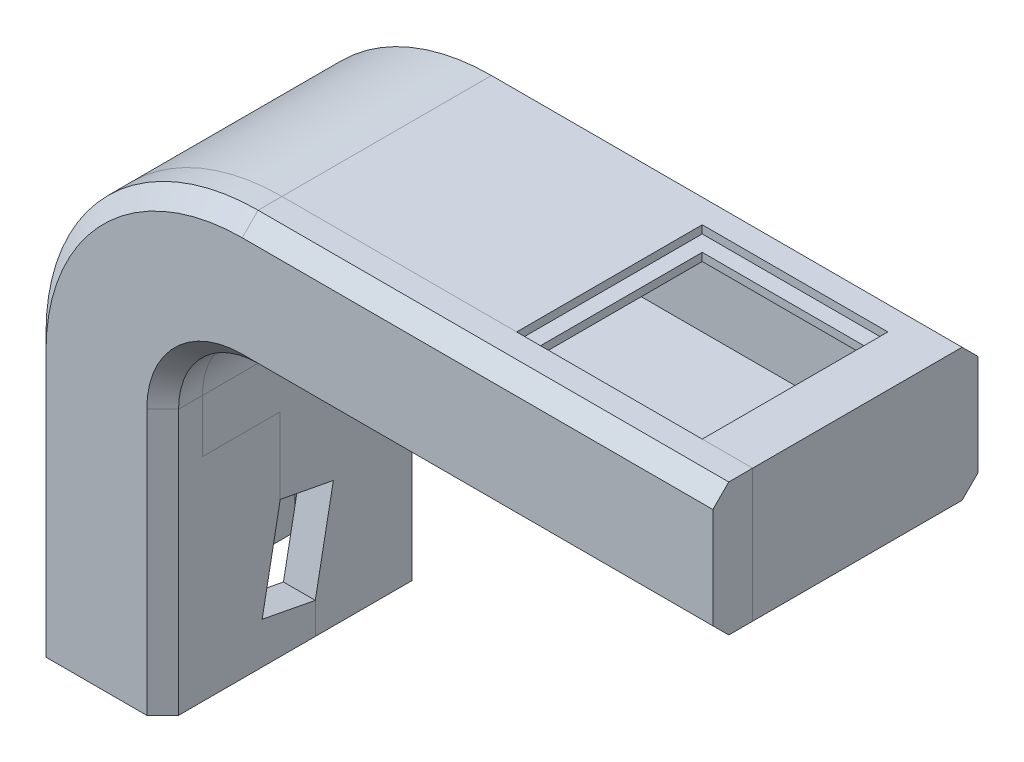
from build123d import *

# Parameters (mm, degrees)
BOSS_EXTRUDE1_DEPTH       = 25
FILLET2_R                 = 15
FILLET3_R                 = 40
FILLET1_SIZE              = 3
SHELL1_T                  = -6
SHELL1_THICKNESS_2_FACE_W = 13
SHELL1_THICKNESS_2_FACE_H = 38
SHELL1_THICKNESS_2_DEPTH  = 4
CUT_EXTRUDE1_DEPTH        = 165.928961981
CUT_EXTRUDE2_REACH        = 140.123
SKETCH3_W                 = 35
SKETCH3_H                 = 35
CUT_EXTRUDE3_DEPTH        = 39.1
CUT_EXTRUDE3_DEPTH_BACK   = 4.1
SKETCH4_W                 = 43.2
SKETCH4_H                 = 3
SPLIT1_SURFACE_1_BACK     = 165.853
SPLIT1_SURFACE_1_DEPTH    = 331.706
SPLIT1_SURFACE_2_BACK     = 165.853
SPLIT1_SURFACE_2_DEPTH    = 331.706


with BuildPart() as part:
    # Sketch1 → Boss-Extrude1 (new, symmetric)
    with BuildSketch(Plane.XY):
        Polygon((-101.75, 10), (-76.75, 10), (-76.75, 75), (27, 75), (27, 100), (-101.75, 100), align=None)
    extrude(amount=BOSS_EXTRUDE1_DEPTH, both=True)

    # Fillet2
    fillet2_edges = [part.edges().sort_by_distance(p)[0] for p in [
        (-76.75, 75, 0),
    ]]
    fillet(fillet2_edges, radius=FILLET2_R)

    # Fillet3
    fillet3_edges = [part.edges().sort_by_distance(p)[0] for p in [
        (-101.75, 100, 0),
    ]]
    fillet(fillet3_edges, radius=FILLET3_R)

    # Fillet1
    fillet1_edges = [part.edges().sort_by_distance(p)[0] for p in [
        (-17.375, 75, -25),
        (-17.375, 100, -25),
        (-17.375, 100, 25),
        (-17.375, 75, 25),
        (-101.75, 35, -25),
        (-101.75, 35, 25),
        (-76.75, 35, -25),
        (-76.75, 35, 25),
        (-90.034271247, 88.284271247, -25),
        (-90.034271247, 88.284271247, 25),
        (-72.356601718, 70.606601718, -25),
        (-72.356601718, 70.606601718, 25),
    ]]
    chamfer(fillet1_edges, length=FILLET1_SIZE)

    # Shell1
    shell1_openings = [part.faces().sort_by_distance(p)[0] for p in [
        (-89.25, 10, 0),
    ]]
    offset(amount=SHELL1_T, openings=shell1_openings)

    # Shell1 thickness 2 face (on inner face of the shell) → Shell1 thickness 2 (cut)
    with BuildSketch(Plane(origin=(21, 87.5, 0), x_dir=(0, 1, 0), z_dir=(1, 0, 0))):
        Rectangle(SHELL1_THICKNESS_2_FACE_W, SHELL1_THICKNESS_2_FACE_H)
    extrude(amount=SHELL1_THICKNESS_2_DEPTH, mode=Mode.SUBTRACT)

    # Sketch2 → Cut-Extrude1 (cut, through all)
    with BuildSketch(Plane.ZY.offset(101.75)):
        Polygon((-3.777731527, 15.89847996), (6.241187326, 17.811923196), (2.827004193, 35.688818166), (-7.19191466, 33.77537493), align=None)
    extrude(amount=-CUT_EXTRUDE1_DEPTH, mode=Mode.SUBTRACT)

    # Sketch3 → Cut-Extrude2 (cut, up to next)
    with BuildSketch(Plane(origin=(0, 100, 0), x_dir=(1, 0, 0), z_dir=(0, 1, 0)), mode=Mode.PRIVATE) as cut_extrude2_sk1:
        Rectangle(SKETCH3_W, SKETCH3_H)
    cut_extrude2_tool1 = extrude(cut_extrude2_sk1.sketch, amount=-CUT_EXTRUDE2_REACH, mode=Mode.PRIVATE) & part.part
    add(cut_extrude2_tool1.solids().sort_by_distance((0, 100, 0))[0], mode=Mode.SUBTRACT)

    # Sketch4 → Cut-Extrude3 (cut, two sides: drawn at the far end of the back side and taken through both)
    with BuildSketch(Plane.XY.offset(-17.5).offset(-CUT_EXTRUDE3_DEPTH_BACK)):
        with Locations((0, 97)):
            Rectangle(SKETCH4_W, SKETCH4_H)
    extrude(amount=CUT_EXTRUDE3_DEPTH + CUT_EXTRUDE3_DEPTH_BACK, mode=Mode.SUBTRACT)


with BuildPart() as body_2:
    # Split1: the piece behind the surface
    add(part.part)
    # Split1 surface: a surface, the sketch's curves swept straight by 331.706 mm
    with BuildLine(Plane.ZY.offset(101.75).offset(-SPLIT1_SURFACE_1_BACK), mode=Mode.PRIVATE) as split1_surface_1_path:
        Line((-3.777731527, 10), (-3.777731527, 15.89847996))
        Line((-3.777731527, 15.89847996), (2.827004193, 35.688818166))
        Line((2.827004193, 35.688818166), (2.827004193, 50))
        Line((2.827004193, 50), (17.5, 50))
        Line((17.5, 50), (17.5, 116.794705416))
    split1_surface_1 = Shell.extrude(split1_surface_1_path.wire(), (-1 * SPLIT1_SURFACE_1_DEPTH, 0 * SPLIT1_SURFACE_1_DEPTH, 0 * SPLIT1_SURFACE_1_DEPTH))
    split(bisect_by=split1_surface_1, keep=Keep.BOTTOM)


with BuildPart() as part_1:
    add(part.part)

    # Split1: split by a surface, the side it looks to stays
    # Split1 surface: a surface, the sketch's curves swept straight by 331.706 mm
    with BuildLine(Plane.ZY.offset(101.75).offset(-SPLIT1_SURFACE_2_BACK), mode=Mode.PRIVATE) as split1_surface_2_path:
        Line((-3.777731527, 10), (-3.777731527, 15.89847996))
        Line((-3.777731527, 15.89847996), (2.827004193, 35.688818166))
        Line((2.827004193, 35.688818166), (2.827004193, 50))
        Line((2.827004193, 50), (17.5, 50))
        Line((17.5, 50), (17.5, 116.794705416))
    split1_surface_2 = Shell.extrude(split1_surface_2_path.wire(), (-1 * SPLIT1_SURFACE_2_DEPTH, 0 * SPLIT1_SURFACE_2_DEPTH, 0 * SPLIT1_SURFACE_2_DEPTH))
    split(bisect_by=split1_surface_2, keep=Keep.TOP)


solid = Compound([body_2.part, part_1.part])
